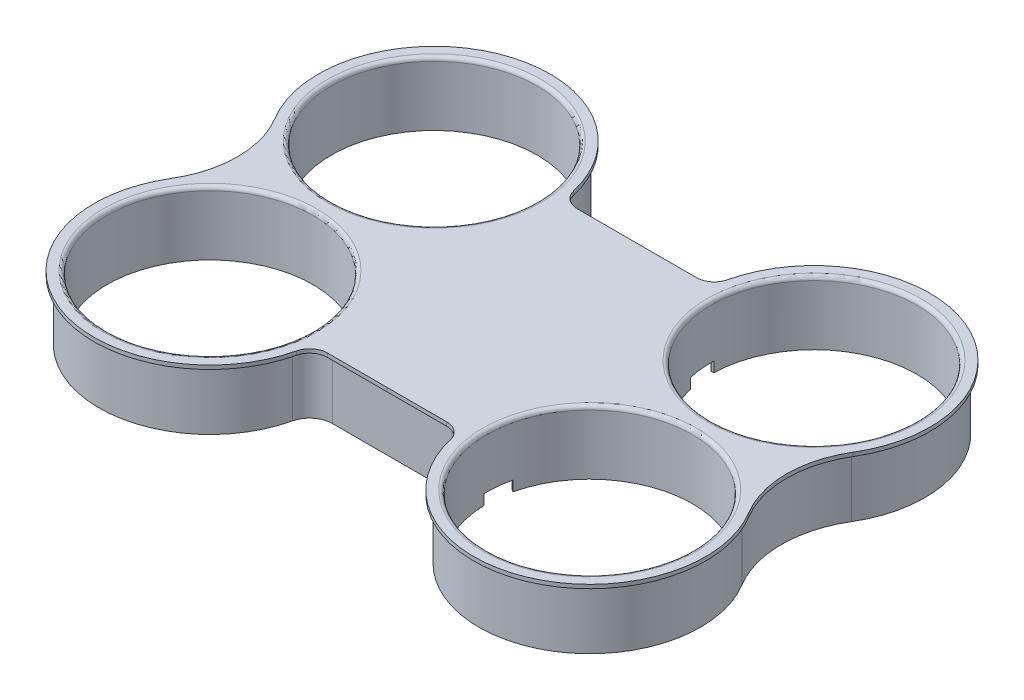
from build123d import *

# Parameters (mm, degrees)
SKETCH1_R           = 40.4
BOSS_EXTRUDE1_DEPTH = 25
SHELL1_T            = -1
FILLET1_R           = 1.5
SWEEP3_START        = 23.5
SWEEP3_DEPTH        = 1.5
CUT_EXTRUDE1_DEPTH  = 4


# Read off the part's stored shape, not the designer's step: Sweep3
with BuildPart() as part:
    # Sketch1 → Boss-Extrude1 (new body)
    with BuildSketch(Plane(origin=(0, 0, 0), x_dir=(1, 0, 0), z_dir=(0, 1, 0))):
        with BuildLine():
            Line((-23.389824888, -47), (23.389824888, -47))
            ThreePointArc((23.389824888, -47), (28.979355918, -48.946125685), (32.151569193, -53.942857143))
            ThreePointArc((32.151569193, -53.942857143), (90.931692418, -84.277158344), (111.718349922, -21.482352941))
            ThreePointArc((111.718349922, -21.482352941), (105.725511342, 0), (111.718349922, 21.482352941))
            ThreePointArc((111.718349922, 21.482352941), (90.931692418, 84.277158344), (32.151569193, 53.942857143))
            ThreePointArc((32.151569193, 53.942857143), (28.979355918, 48.946125685), (23.389824888, 47))
            Line((23.389824888, 47), (-23.389824888, 47))
            ThreePointArc((-23.389824888, 47), (-28.979355918, 48.946125685), (-32.151569193, 53.942857143))
            ThreePointArc((-32.151569193, 53.942857143), (-90.931692418, 84.277158344), (-111.718349922, 21.482352941))
            ThreePointArc((-111.718349922, 21.482352941), (-105.725511342, 0), (-111.718349922, -21.482352941))
            ThreePointArc((-111.718349922, -21.482352941), (-90.931692418, -84.277158344), (-32.151569193, -53.942857143))
            ThreePointArc((-32.151569193, -53.942857143), (-28.979355918, -48.946125685), (-23.389824888, -47))
        make_face()
        with Locations(Location((74.5, -44, 0), (0, 0, 270))):
            Circle(SKETCH1_R, mode=Mode.SUBTRACT)
        with Locations(Location((74.5, 44, 0), (0, 0, 270))):
            Circle(SKETCH1_R, mode=Mode.SUBTRACT)
        with Locations(Location((-74.5, 44, 0), (0, 0, 270))):
            Circle(SKETCH1_R, mode=Mode.SUBTRACT)
        with Locations(Location((-74.5, -44, 0), (0, 0, 270))):
            Circle(SKETCH1_R, mode=Mode.SUBTRACT)
    extrude(amount=BOSS_EXTRUDE1_DEPTH)

    # Shell1
    shell1_openings = [part.faces().sort_by_distance(p)[0] for p in [
        (0, 0, 0),
    ]]
    offset(amount=SHELL1_T, openings=shell1_openings, kind=Kind.INTERSECTION)

    # Fillet1
    fillet1_edges = [part.edges().sort_by_distance(p)[0] for p in [
        (74.5, 25, 3.6),
        (74.5, 25, -84.4),
        (-74.5, 25, -84.4),
        (-74.5, 25, 3.6),
    ]]
    fillet(fillet1_edges, radius=FILLET1_R)

    # Sweep3 outline → Sweep3 (add)
    with BuildSketch(Plane(origin=(0, 0, 0), x_dir=(1, 0, 0), z_dir=(0, 1, 0)).offset(SWEEP3_START)):
        with BuildLine():
            Line((-23.389824888, -49), (23.389824888, -49))
            ThreePointArc((23.389824888, -49), (27.737237912, -50.51365331), (30.204514903, -54.4))
            ThreePointArc((30.204514903, -54.4), (91.687172529, -86.128981716), (113.429538424, -20.447058824))
            ThreePointArc((113.429538424, -20.447058824), (107.725511342, 0), (113.429538424, 20.447058824))
            ThreePointArc((113.429538424, 20.447058824), (91.687172529, 86.128981716), (30.204514903, 54.4))
            ThreePointArc((30.204514903, 54.4), (27.737237912, 50.51365331), (23.389824888, 49))
            Line((23.389824888, 49), (-23.389824888, 49))
            ThreePointArc((-23.389824888, 49), (-27.737237912, 50.51365331), (-30.204514903, 54.4))
            ThreePointArc((-30.204514903, 54.4), (-91.687172529, 86.128981716), (-113.429538424, 20.447058824))
            ThreePointArc((-113.429538424, 20.447058824), (-107.725511342, 0), (-113.429538424, -20.447058824))
            ThreePointArc((-113.429538424, -20.447058824), (-91.687172529, -86.128981716), (-30.204514903, -54.4))
            ThreePointArc((-30.204514903, -54.4), (-27.737237912, -50.51365331), (-23.389824888, -49))
        make_face()
        with BuildLine():
            ThreePointArc((-111.718349922, -21.482352941), (-105.725511342, 0), (-111.718349922, 21.482352941))
            ThreePointArc((-111.718349922, 21.482352941), (-90.931692418, 84.277158344), (-32.151569193, 53.942857143))
            ThreePointArc((-32.151569193, 53.942857143), (-28.979355918, 48.946125685), (-23.389824888, 47))
            Line((-23.389824888, 47), (23.389824888, 47))
            ThreePointArc((23.389824888, 47), (28.979355918, 48.946125685), (32.151569193, 53.942857143))
            ThreePointArc((32.151569193, 53.942857143), (90.931692418, 84.277158344), (111.718349922, 21.482352941))
            ThreePointArc((111.718349922, 21.482352941), (105.725511342, 0), (111.718349922, -21.482352941))
            ThreePointArc((111.718349922, -21.482352941), (90.931692418, -84.277158344), (32.151569193, -53.942857143))
            ThreePointArc((32.151569193, -53.942857143), (28.979355918, -48.946125685), (23.389824888, -47))
            Line((23.389824888, -47), (-23.389824888, -47))
            ThreePointArc((-23.389824888, -47), (-28.979355918, -48.946125685), (-32.151569193, -53.942857143))
            ThreePointArc((-32.151569193, -53.942857143), (-90.931692418, -84.277158344), (-111.718349922, -21.482352941))
        make_face(mode=Mode.SUBTRACT)
    extrude(amount=SWEEP3_DEPTH)

    # Sketch11 → Cut-Extrude1 (cut)
    with BuildSketch(Plane(origin=(0, 0, 0), x_dir=(1, 0, 0), z_dir=(0, 1, 0))):
        with BuildLine():
            Line((-33.218669872, 45.046086874), (-34.11587702, 45.132524243))
            ThreePointArc((-34.11587702, 45.132524243), (-34.304886561, 39.936398688), (-35.15969651, 34.807583489))
            ThreePointArc((-35.15969651, 34.807583489), (-34.700986823, 34.532231781), (-34.274323948, 34.20944403))
            ThreePointArc((-34.274323948, 34.20944403), (-33.336128547, 39.584607949), (-33.112976312, 45.036470093))
            ThreePointArc((-33.112976312, 45.036470093), (-33.16583585, 45.041138266), (-33.218669872, 45.046086874))
        make_face()
        with BuildLine():
            ThreePointArc((33.218669872, 45.046086874), (33.16583585, 45.041138266), (33.112976312, 45.036470093))
            ThreePointArc((33.112976312, 45.036470093), (33.336128547, 39.584607949), (34.274323948, 34.20944403))
            ThreePointArc((34.274323948, 34.20944403), (34.700986823, 34.532231781), (35.15969651, 34.807583489))
            ThreePointArc((35.15969651, 34.807583489), (34.304886561, 39.936398688), (34.11587702, 45.132524243))
            Line((34.11587702, 45.132524243), (33.218669872, 45.046086874))
        make_face()
        with BuildLine():
            ThreePointArc((-33.112976312, -45.036470093), (-33.336128547, -39.584607949), (-34.274323948, -34.20944403))
            ThreePointArc((-34.274323948, -34.20944403), (-34.700986823, -34.532231781), (-35.15969651, -34.807583489))
            ThreePointArc((-35.15969651, -34.807583489), (-34.304886561, -39.936398688), (-34.11587702, -45.132524243))
            Line((-34.11587702, -45.132524243), (-33.218669872, -45.046086874))
            ThreePointArc((-33.218669872, -45.046086874), (-33.16583585, -45.041138266), (-33.112976312, -45.036470093))
        make_face()
        with BuildLine():
            ThreePointArc((35.15969651, -34.807583489), (34.700986823, -34.532231781), (34.274323948, -34.20944403))
            ThreePointArc((34.274323948, -34.20944403), (33.336128547, -39.584607949), (33.112976312, -45.036470093))
            ThreePointArc((33.112976312, -45.036470093), (33.16583585, -45.041138266), (33.218669872, -45.046086874))
            Line((33.218669872, -45.046086874), (34.11587702, -45.132524243))
            ThreePointArc((34.11587702, -45.132524243), (34.304886561, -39.936398688), (35.15969651, -34.807583489))
        make_face()
    extrude(amount=CUT_EXTRUDE1_DEPTH, mode=Mode.SUBTRACT)


solid = part.part
